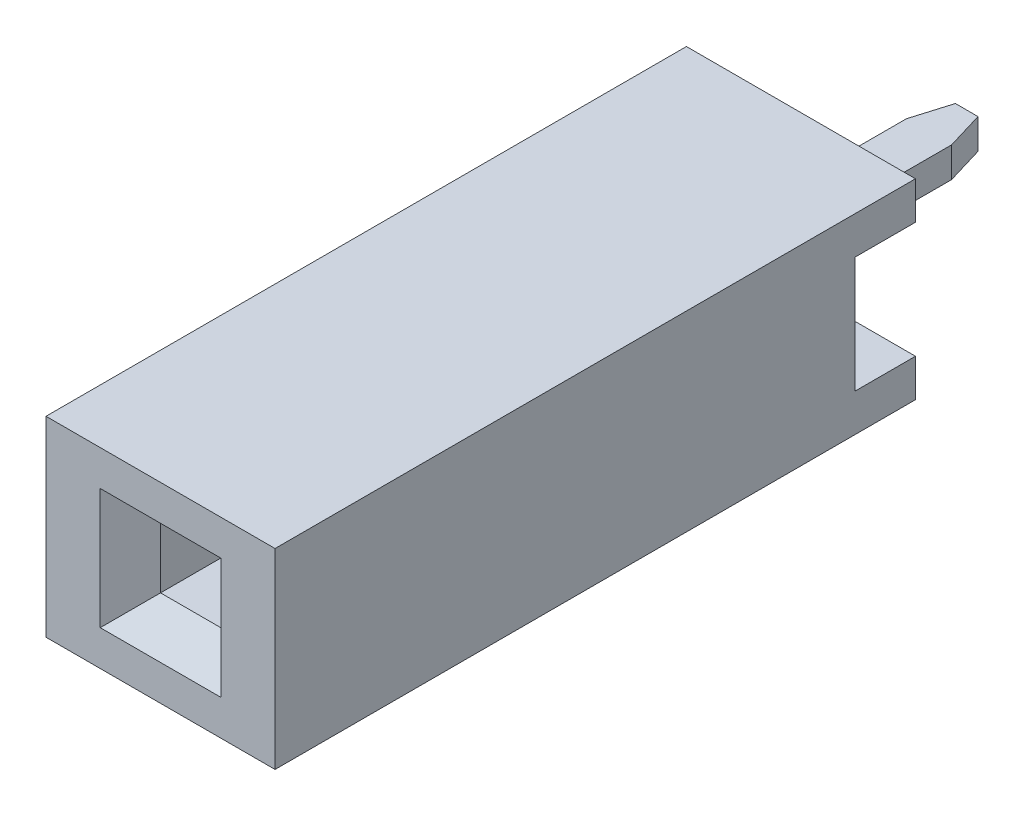
from build123d import *

# Parameters (mm, degrees)
SKETCH1_W           = 2.54
SKETCH1_H           = 8.5
BOSS_EXTRUDE1_DEPTH = 1.52
SKETCH_1_W          = 0.8
SKETCH_1_H          = 1.54
CUT_EXTRUDE_1_DEPTH = 10.116166958
SKETCH2_W           = 0.8
SKETCH2_H           = 0.8
CUT_EXTRUDE1_DEPTH  = 7
CHAMFER_1_SIZE      = 0.4
BOSS_EXTRUDE2_DEPTH = 0.2


with BuildPart() as part:
    # Sketch1 → Boss-Extrude1 (new, symmetric)
    with BuildSketch(Plane(origin=(0, 0, 0), x_dir=(0, -1, 0), z_dir=(1, 0, 0))):
        with Locations((0, -4.25)):
            Rectangle(SKETCH1_W, SKETCH1_H)
    extrude(amount=BOSS_EXTRUDE1_DEPTH, both=True)

    # Эскиз1 → Вырез-Вытянуть1 (cut, through all)
    with BuildSketch(Plane(origin=(1.52, 0, 0), x_dir=(0, 0, -1), z_dir=(1, 0, 0))):
        with Locations((-0.4, 0)):
            Rectangle(SKETCH_1_W, SKETCH_1_H)
    extrude(amount=-CUT_EXTRUDE_1_DEPTH, mode=Mode.SUBTRACT)

    # Sketch2 → Cut-Extrude1 (cut)
    with BuildSketch(Plane(origin=(0, 0, 8.5), x_dir=(-1, 0, 0), z_dir=(0, 0, 1))):
        Rectangle(SKETCH2_W, SKETCH2_H)
    extrude(amount=-CUT_EXTRUDE1_DEPTH, mode=Mode.SUBTRACT)

    # Фаска1
    chamfer_1_edges = [part.edges().sort_by_distance(p)[0] for p in [
        (0, -0.4, 8.5),
        (0.4, 0, 8.5),
        (0, 0.4, 8.5),
        (-0.4, 0, 8.5),
    ]]
    chamfer(chamfer_1_edges, length=CHAMFER_1_SIZE)

    # Sketch3 → Boss-Extrude2 (add, symmetric)
    with BuildSketch(Plane(origin=(0, 0, 0), x_dir=(1, 0, 0), z_dir=(0, 1, 0))):
        Polygon((-0.3, 0), (-0.3, 1.7), (-0.15, 2.2), (0.15, 2.2), (0.3, 1.7), (0.3, 0), (0.3, -0.8), (-0.3, -0.8), align=None)
        Polygon((0.4, -1.5), (-0.4, -1.5), (-0.4, -6.9), (-0.3, -6.9), (-0.3, -1.6), (0.3, -1.6), (0.3, -6.9), (0.4, -6.9), align=None)
    extrude(amount=BOSS_EXTRUDE2_DEPTH, both=True)


solid = part.part
